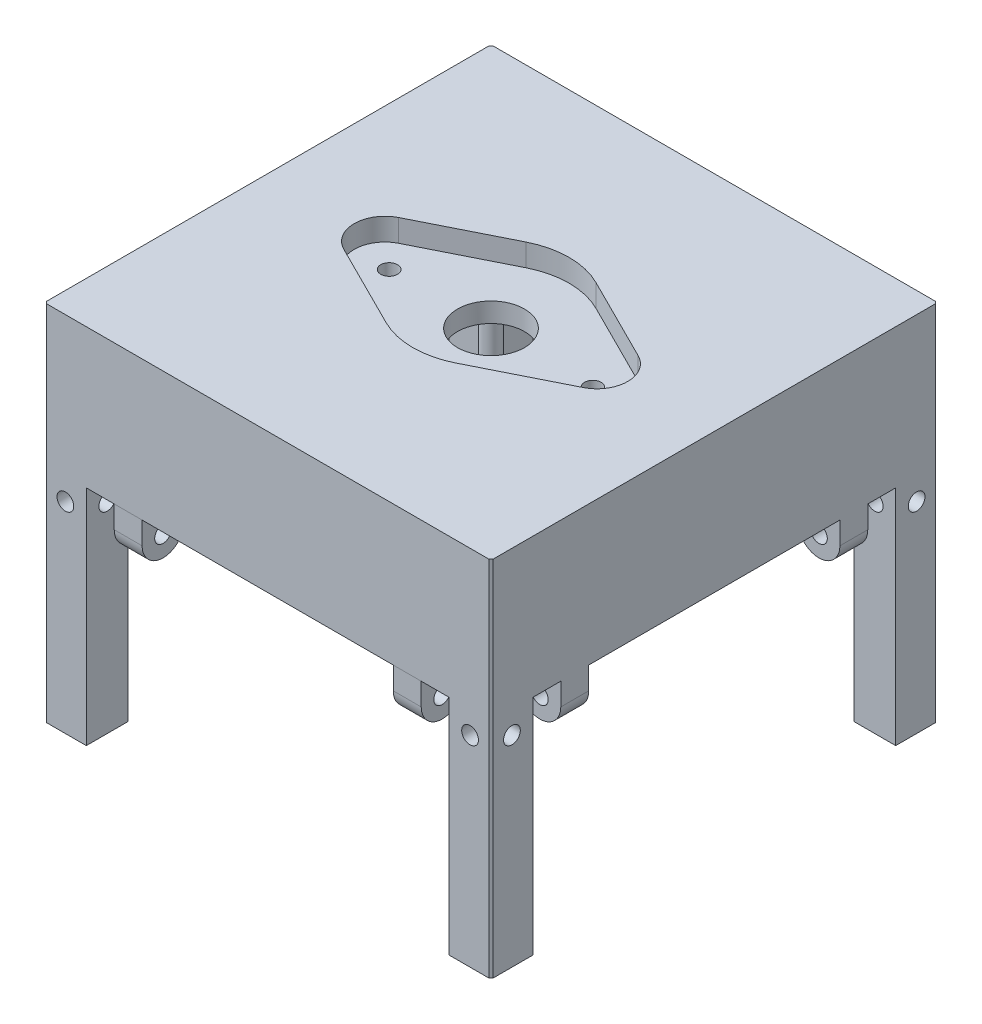
from build123d import *

# Parameters (mm, degrees)
MAIN_EXTRUDE_DEPTH               = 65
SHELL2_T                         = -7.5
SKETCH14_R                       = 6
TOP_HOLE_DEPTH                   = 7.5
SKETCH24_W                       = 65
SKETCH24_H                       = 7.5
MAIN_DOOR_DEPTH                  = 40
DOOR_MIRROR_COUNT                = 4
SKETCH35_R                       = 1.5
DOOR_ROUNDING_DEPTH              = 65
SKETCH35_3_R                     = 1.5
DOOR_SCREW_DEPTH                 = 106.267516357
SKETCH39_W                       = 22.5
SKETCH39_H                       = 7.5
SKETCH39_W_2                     = 5
DOOR_TEETH_DEPTH                 = 7.75
CIRPATTERN15_START               = -40
CIRPATTERN15_OUTLINE_R           = 1.5
CIRPATTERN15_DEPTH               = 80
CIRPATTERN15_START_2             = -27.5
CIRPATTERN15_2_OUTLINE_R         = 1.5
CIRPATTERN15_2_DEPTH             = 5
CIRPATTERN15_START_3             = 22.5
CIRPATTERN15_3_OUTLINE_R         = 1.5
CIRPATTERN15_3_DEPTH             = 5
CIRPATTERN15_4_OUTLINE_R         = 1.5
CIRPATTERN15_4_DEPTH             = 80
CIRPATTERN15_5_OUTLINE_R         = 1.5
CIRPATTERN15_5_DEPTH             = 5
CIRPATTERN15_6_OUTLINE_R         = 1.5
CIRPATTERN15_6_DEPTH             = 5
SKETCH40_R                       = 1.6
BOLT_GUIDE_DEPTH                 = 50
SHELL_CORNER_FILLET_R            = 5
SKETCH41_R                       = 1.5
SCREW_HOLDER_PLACE_DEPTH         = 4
SKETCH41_2_R                     = 1.5
SCREW_HOLDER_HOLES_DEPTH         = 7.5
SPRING_BACK_SUPPORT_DEPTH        = 3
SPRING_BACK_SUPPORT_SUPPORT_SIZE = 3
SPRING_CUT_OUTS_DEPTH            = 6.5


with BuildPart() as part:
    # Sketch11 → main-extrude (new body)
    with BuildSketch(Plane(origin=(0, 0, 0), x_dir=(1, 0, 0), z_dir=(0, 1, 0))):
        Polygon((39.6, 40), (0, 40), (-39.6, 40), (-40, 39.6), (-40, 0), (-40, -39.6), (-39.6, -40), (0, -40), (39.6, -40), (40, -39.6), (40, 0), (40, 39.6), align=None)
    extrude(amount=MAIN_EXTRUDE_DEPTH)

    # Shell2
    shell2_openings = [part.faces().sort_by_distance(p)[0] for p in [
        (0, 0, 0),
    ]]
    offset(amount=SHELL2_T, openings=shell2_openings)

    # Sketch14 → top-hole (cut)
    with BuildSketch(Plane(origin=(0, 65, 0), x_dir=(1, 0, 0), z_dir=(0, 1, 0))):
        with Locations(Location((0, 0, 0), (0, 0, 270))):
            Circle(SKETCH14_R)
    extrude(amount=-TOP_HOLE_DEPTH, mode=Mode.SUBTRACT)

    # Sketch24 → main-door (cut)
    with BuildSketch(Plane.XZ):
        with Locations((0, 36.25)):
            Rectangle(SKETCH24_W, SKETCH24_H)
    main_door = extrude(amount=-MAIN_DOOR_DEPTH, mode=Mode.SUBTRACT)

    # door-mirror: main-door ×4 about axis
    door_mirror_axis = Axis((0, 0, 0), (0, 1, 0))
    for i in range(1, DOOR_MIRROR_COUNT):
        add(main_door.rotate(door_mirror_axis, i * 360 / DOOR_MIRROR_COUNT), mode=Mode.SUBTRACT)

    # Sketch35<3> → door-screw (cut, symmetric)
    with BuildSketch(Plane.ZY.offset(-32.5)):
        with Locations(Location((36.25, 36, 0), (0, 0, 180))):
            Circle(SKETCH35_3_R)
    extrude(amount=DOOR_SCREW_DEPTH, both=True, mode=Mode.SUBTRACT)

    # CirPattern15: read off the stored shape, not the designer's step
    # CirPattern15 outline → CirPattern15 (cut)
    with BuildSketch(Plane.XY.offset(CIRPATTERN15_START)):
        with Locations((-36.25, 36)):
            Circle(CIRPATTERN15_OUTLINE_R)
        with Locations((36.25, 36)):
            Circle(CIRPATTERN15_OUTLINE_R)
    extrude(amount=CIRPATTERN15_DEPTH, mode=Mode.SUBTRACT)

    # CirPattern15 2 outline → CirPattern15 2 (add)
    # profile 1 of 2: a face of its own
    with BuildSketch(Plane.XY.offset(CIRPATTERN15_START_2)):
        with BuildLine():
            ThreePointArc((-40, 36), (-36.25, 32.25), (-32.5, 36))
            Line((-32.5, 36), (-32.5, 40))
            Line((-32.5, 40), (-40, 40))
            Line((-40, 40), (-40, 36))
        make_face()
        with Locations((-36.25, 36)):
            Circle(CIRPATTERN15_2_OUTLINE_R, mode=Mode.SUBTRACT)
    # profile 2 of 2: a face of its own
    with BuildSketch(Plane.XY.offset(CIRPATTERN15_START_2)):
        with BuildLine():
            Line((40, 40), (32.5, 40))
            Line((32.5, 40), (32.5, 36))
            ThreePointArc((32.5, 36), (36.25, 32.25), (40, 36))
            Line((40, 36), (40, 40))
        make_face()
        with Locations((36.25, 36)):
            Circle(CIRPATTERN15_2_OUTLINE_R, mode=Mode.SUBTRACT)
    extrude(amount=CIRPATTERN15_2_DEPTH)

    # CirPattern15 3 outline → CirPattern15 3 (add)
    # profile 1 of 2: a face of its own
    with BuildSketch(Plane.XY.offset(CIRPATTERN15_START_3)):
        with BuildLine():
            ThreePointArc((-40, 36), (-36.25, 32.25), (-32.5, 36))
            Line((-32.5, 36), (-32.5, 40))
            Line((-32.5, 40), (-40, 40))
            Line((-40, 40), (-40, 36))
        make_face()
        with Locations((-36.25, 36)):
            Circle(CIRPATTERN15_3_OUTLINE_R, mode=Mode.SUBTRACT)
    # profile 2 of 2: a face of its own
    with BuildSketch(Plane.XY.offset(CIRPATTERN15_START_3)):
        with BuildLine():
            Line((40, 40), (32.5, 40))
            Line((32.5, 40), (32.5, 36))
            ThreePointArc((32.5, 36), (36.25, 32.25), (40, 36))
            Line((40, 36), (40, 40))
        make_face()
        with Locations((36.25, 36)):
            Circle(CIRPATTERN15_3_OUTLINE_R, mode=Mode.SUBTRACT)
    extrude(amount=CIRPATTERN15_3_DEPTH)

    # CirPattern15 4 outline → CirPattern15 4 (cut)
    with BuildSketch(Plane.YZ.offset(CIRPATTERN15_START)):
        with Locations((36, -36.25)):
            Circle(CIRPATTERN15_4_OUTLINE_R)
    extrude(amount=CIRPATTERN15_4_DEPTH, mode=Mode.SUBTRACT)

    # CirPattern15 5 outline → CirPattern15 5 (add)
    with BuildSketch(Plane.YZ.offset(CIRPATTERN15_START_2)):
        with BuildLine():
            Line((40, -40), (40, -32.5))
            Line((40, -32.5), (36, -32.5))
            ThreePointArc((36, -32.5), (32.25, -36.25), (36, -40))
            Line((36, -40), (40, -40))
        make_face()
        with Locations((36, -36.25)):
            Circle(CIRPATTERN15_5_OUTLINE_R, mode=Mode.SUBTRACT)
    extrude(amount=CIRPATTERN15_5_DEPTH)

    # CirPattern15 6 outline → CirPattern15 6 (add)
    with BuildSketch(Plane.YZ.offset(CIRPATTERN15_START_3)):
        with BuildLine():
            Line((40, -40), (40, -32.5))
            Line((40, -32.5), (36, -32.5))
            ThreePointArc((36, -32.5), (32.25, -36.25), (36, -40))
            Line((36, -40), (40, -40))
        make_face()
        with Locations((36, -36.25)):
            Circle(CIRPATTERN15_6_OUTLINE_R, mode=Mode.SUBTRACT)
    extrude(amount=CIRPATTERN15_6_DEPTH)

    # Sketch40 → bolt-guide (add)
    with BuildSketch(Plane.XZ.offset(-57.5)):
        with Locations(Location((-5.656854249, -5.656854249, 0), (0, 0, 90))):
            Circle(SKETCH40_R)
        with Locations(Location((5.656854249, 5.656854249, 0), (0, 0, 90))):
            Circle(SKETCH40_R)
    extrude(amount=BOLT_GUIDE_DEPTH)

    # shell-corner-fillet
    shell_corner_fillet_edges = [part.edges().sort_by_distance(p)[0] for p in [
        (32.5, 57.5, 0),
        (0, 57.5, -32.5),
        (-32.5, 57.5, 0),
        (0, 57.5, 32.5),
    ]]
    fillet(shell_corner_fillet_edges, radius=SHELL_CORNER_FILLET_R)

    # Sketch41 → screw-holder-place (cut)
    with BuildSketch(Plane(origin=(0, 65, 0), x_dir=(1, 0, 0), z_dir=(0, 1, 0))):
        with BuildLine():
            Line((-21.460526316, 4.918923688), (-6.263157895, 12.520896661))
            ThreePointArc((-6.263157895, 12.520896661), (0, 14), (6.263157895, 12.520896661))
            Line((6.263157895, 12.520896661), (21.460526316, 4.918923688))
            ThreePointArc((21.460526316, 4.918923688), (24.5, 0), (21.460526316, -4.918923688))
            Line((21.460526316, -4.918923688), (6.263157895, -12.520896661))
            ThreePointArc((6.263157895, -12.520896661), (0, -14), (-6.263157895, -12.520896661))
            Line((-6.263157895, -12.520896661), (-21.460526316, -4.918923688))
            ThreePointArc((-21.460526316, -4.918923688), (-24.5, 0), (-21.460526316, 4.918923688))
        make_face()
        with Locations(Location((-18.25, 0, 0), (0, 0, 270))):
            Circle(SKETCH41_R, mode=Mode.SUBTRACT)
        with Locations(Location((18.25, 0, 0), (0, 0, 90))):
            Circle(SKETCH41_R, mode=Mode.SUBTRACT)
    extrude(amount=-SCREW_HOLDER_PLACE_DEPTH, mode=Mode.SUBTRACT)

    # Sketch41<2> → screw-holder-holes (cut)
    with BuildSketch(Plane(origin=(0, 65, 0), x_dir=(1, 0, 0), z_dir=(0, 1, 0))):
        with Locations(Location((-18.25, 0, 0), (0, 0, 270))):
            Circle(SKETCH41_2_R)
        with Locations(Location((18.25, 0, 0), (0, 0, 270))):
            Circle(SKETCH41_2_R)
    extrude(amount=-SCREW_HOLDER_HOLES_DEPTH, mode=Mode.SUBTRACT)

    # Sketch46 → spring-cut-outs (cut)
    with BuildSketch(Plane.ZY.offset(40)):
        Polygon((-22.5, 40), (-22.5, 36), (0, 36), (22.5, 36), (22.5, 40), (22.5, 47), (0, 47), (-22.5, 47), align=None)
    extrude(amount=-SPRING_CUT_OUTS_DEPTH, mode=Mode.SUBTRACT)


with BuildPart() as body_2:
    # Sketch35 → door-rounding (new body)
    with BuildSketch(Plane.ZY.offset(-32.5)):
        with BuildLine():
            Line((32.5, 40), (32.5, 36))
            ThreePointArc((32.5, 36), (36.25, 32.25), (40, 36))
            Line((40, 36), (40, 40))
            Line((40, 40), (32.5, 40))
        make_face()
        with Locations(Location((36.25, 36, 0), (0, 0, 180))):
            Circle(SKETCH35_R, mode=Mode.SUBTRACT)
    extrude(amount=DOOR_ROUNDING_DEPTH)

    # Sketch39 → door-teeth (cut)
    with BuildSketch(Plane.XZ.offset(-32.25)):
        with Locations((11.25, 36.25)):
            Rectangle(SKETCH39_W, SKETCH39_H)
        with Locations((-11.25, 36.25)):
            Rectangle(SKETCH39_W, SKETCH39_H)
        with Locations((30, 36.25)):
            Rectangle(SKETCH39_W_2, SKETCH39_H)
        with Locations((-30, 36.25)):
            Rectangle(SKETCH39_W_2, SKETCH39_H)
    extrude(amount=-DOOR_TEETH_DEPTH, mode=Mode.SUBTRACT)


with BuildPart() as door_teeth_piece_1:
    # of the separate pieces the step leaves, piece 1, a body of its own (door_teeth_pieces)
    add(body_2.part.solids().sort_by_distance((27.5, 40, 40))[0])


with BuildPart() as door_teeth_piece_2:
    # of the separate pieces the step leaves, piece 2, a body of its own (door_teeth_pieces)
    add(body_2.part.solids().sort_by_distance((-22.5, 40, 40))[0])


with BuildPart() as body_4:
    # Sketch45 → spring-back-support (new body)
    with BuildSketch(Plane(origin=(-32.5, 0, 0), x_dir=(0, 0, -1), z_dir=(1, 0, 0))):
        Polygon((-22.5, 40), (22.5, 40), (25.5, 40), (25.5, 48), (22.5, 48), (-22.5, 48), (-25.5, 48), (-25.5, 40), align=None)
    extrude(amount=SPRING_BACK_SUPPORT_DEPTH)

    # spring-back-support-support
    spring_back_support_support_edges = [body_4.edges().sort_by_distance(p)[0] for p in [
        (-29.5, 44, 25.5),
        (-29.5, 48, 0),
        (-29.5, 44, -25.5),
    ]]
    chamfer(spring_back_support_support_edges, length=SPRING_BACK_SUPPORT_SUPPORT_SIZE - 0.0001)  # a hair under: the kernel refuses the full size


solid = Compound([part.part, door_teeth_piece_1.part, door_teeth_piece_2.part, body_4.part])
